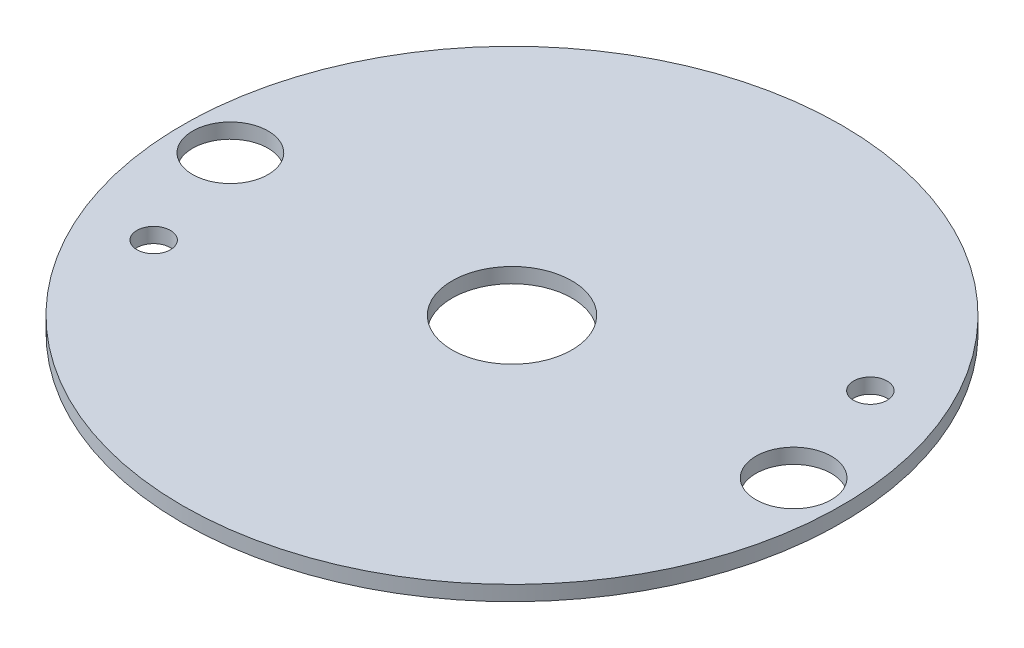
from build123d import *

# Parameters (mm, degrees)
SKETCH1_R           = 69.85
SKETCH1_R_2         = 12.7
BOSS_EXTRUDE1_DEPTH = 3.175
SKETCH2_R           = 8.001
SKETCH2_R_2         = 3.556
CUT_EXTRUDE1_DEPTH  = 3.175


with BuildPart() as part:
    # Sketch1 → Boss-Extrude1 (new body)
    with BuildSketch(Plane(origin=(0, 0, 0), x_dir=(1, 0, 0), z_dir=(0, 1, 0))):
        Circle(SKETCH1_R)
        Circle(SKETCH1_R_2, mode=Mode.SUBTRACT)
    extrude(amount=BOSS_EXTRUDE1_DEPTH)

    # Sketch2 → Cut-Extrude1 (cut)
    with BuildSketch(Plane(origin=(0, 3.175, 0), x_dir=(1, 0, 0), z_dir=(0, 1, 0))):
        with Locations((-59.69, 0)):
            Circle(SKETCH2_R)
        with Locations((59.69, 0)):
            Circle(SKETCH2_R)
        with Locations((-51.795490029, -24.152633658)):
            Circle(SKETCH2_R_2)
        with Locations((51.795490029, 24.152633658)):
            Circle(SKETCH2_R_2)
    extrude(amount=-CUT_EXTRUDE1_DEPTH, mode=Mode.SUBTRACT)


solid = part.part
